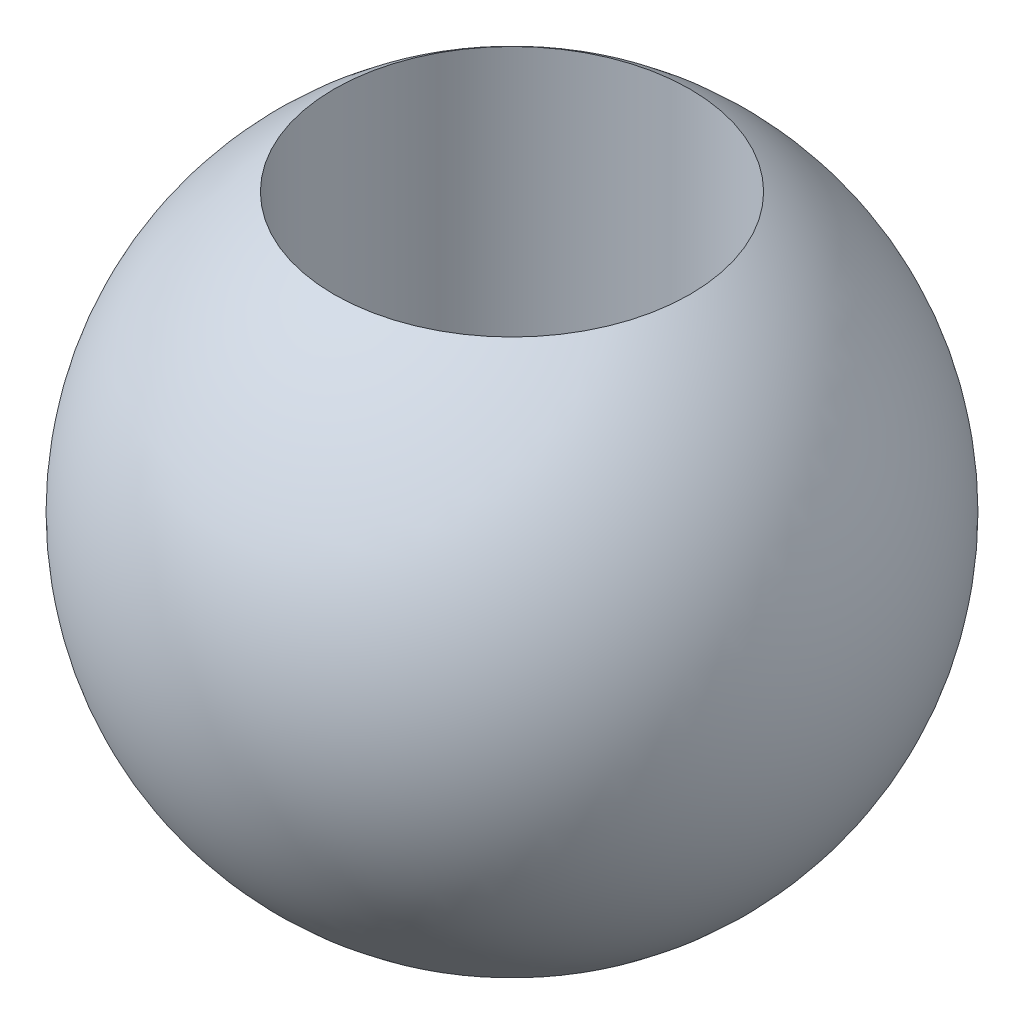
from build123d import *


with BuildPart() as part:
    # Sketch1 → Revolve1 (revolve)
    with BuildSketch(Plane.XY):
        with BuildLine():
            ThreePointArc((1.3716, -2.137829142), (2.54, 0), (1.3716, 2.137829142))
            Line((1.3716, 2.137829142), (1.3716, -2.137829142))
        make_face()
    revolve(axis=Axis((0, 2.54, 0), (0, -1, 0)))


solid = part.part
